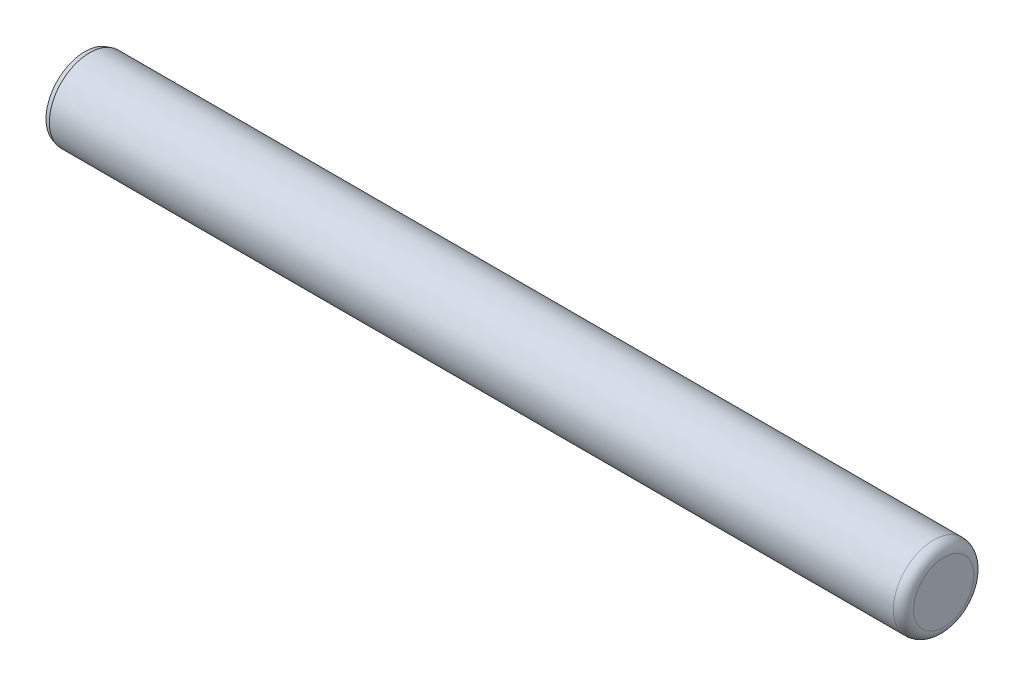
from build123d import *


with BuildPart() as part:
    # Sketch3 → Revolve1 (revolve)
    with BuildSketch(Plane.XY):
        with BuildLine():
            Line((101.6, 7.1374), (101.6, 0))
            Line((101.6, 0), (-101.6, 0))
            Line((-101.6, 0), (-101.6, 9.2075))
            Line((-101.6, 9.2075), (-100.492745914, 9.525))
            Line((-100.492745914, 9.525), (99.2124, 9.525))
            ThreePointArc((99.2124, 9.525), (100.900688151, 8.825688151), (101.6, 7.1374))
        make_face()
    revolve(axis=Axis((-101.6, 0, 0), (1, 0, 0)))


solid = part.part
